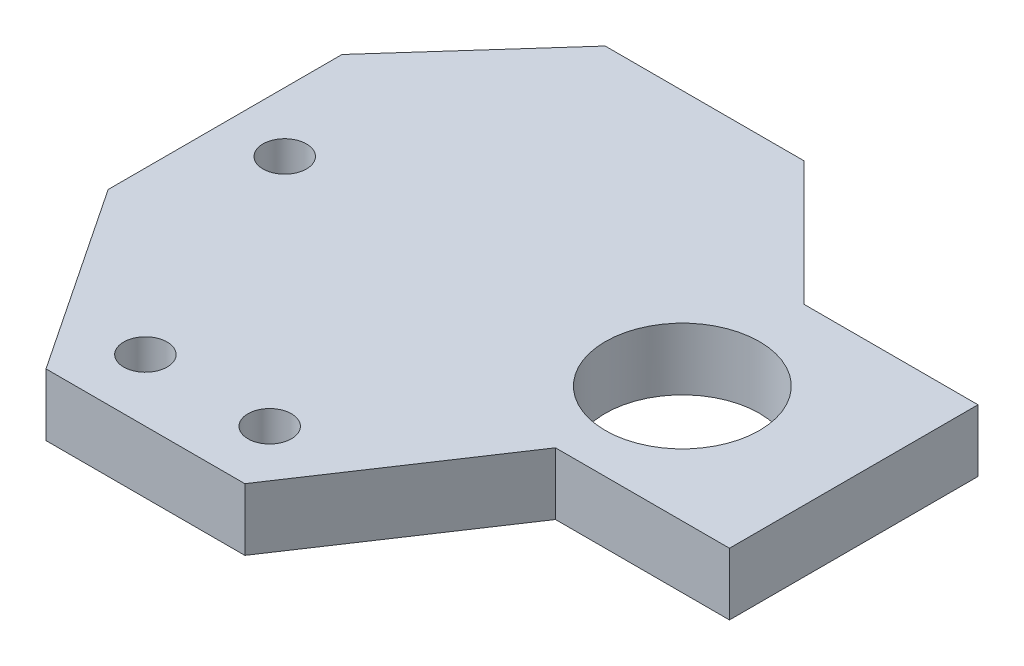
from build123d import *

# Parameters (mm, degrees)
SKETCH1_R           = 1.75
BOSS_EXTRUDE1_DEPTH = 5
SKETCH2_R           = 1.75
SKETCH2_R_2         = 6.2
CUT_EXTRUDE1_DEPTH  = 10


with BuildPart() as part:
    # Sketch1 → Boss-Extrude1 (new body)
    with BuildSketch(Plane(origin=(0, 0, 0), x_dir=(1, 0, 0), z_dir=(0, 1, 0))):
        Polygon((10, 45), (0, 33.819660113), (0, 15), (10, 0), (26, 0), (36, 15), (50, 15), (50, 35), (36, 35), (26, 45), align=None)
        with Locations((13, 5)):
            Circle(SKETCH1_R, mode=Mode.SUBTRACT)
        with Locations((23, 5)):
            Circle(SKETCH1_R, mode=Mode.SUBTRACT)
    extrude(amount=BOSS_EXTRUDE1_DEPTH)

    # Sketch2 → Cut-Extrude1 (cut)
    with BuildSketch(Plane(origin=(0, 0, 0), x_dir=(-1, 0, 0), z_dir=(0, -1, 0))):
        with Locations((-4.8, 24.409830056)):
            Circle(SKETCH2_R)
        with Locations((-36.8, 24.409830056)):
            Circle(SKETCH2_R_2)
    extrude(amount=-CUT_EXTRUDE1_DEPTH, mode=Mode.SUBTRACT)


solid = part.part
